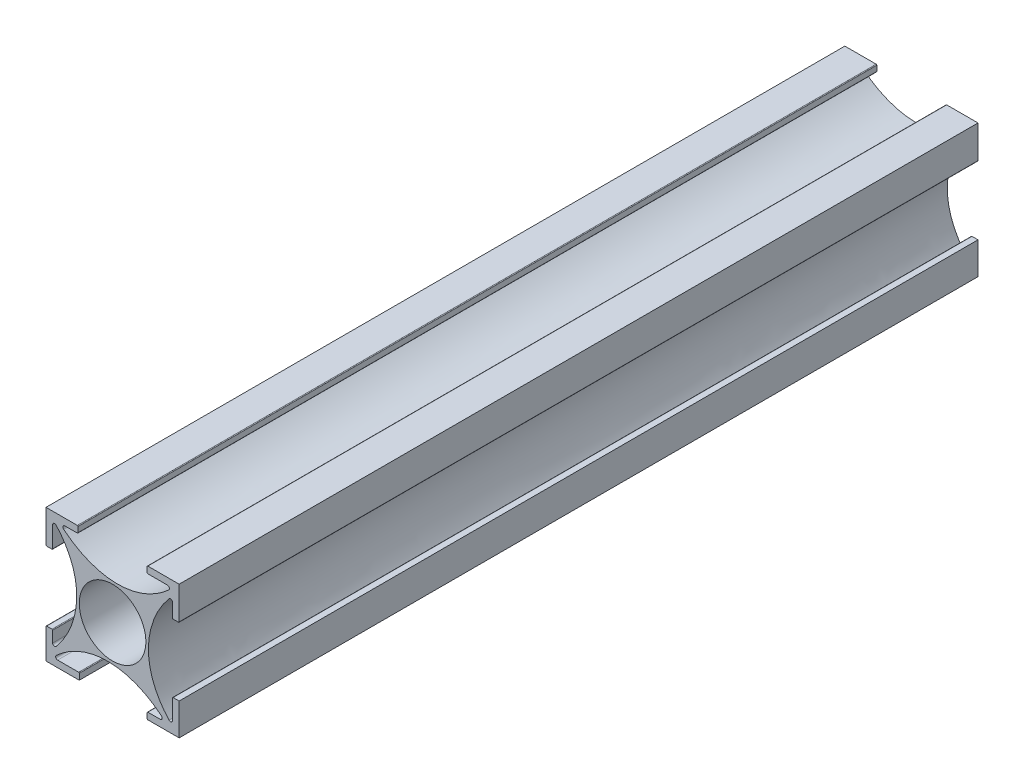
from build123d import *

# Parameters (mm, degrees)
SKETCH1_W           = 20
SKETCH1_H           = 20
BOSS_EXTRUDE1_DEPTH = 120
SKETCH2_R           = 5
BOSS_EXTRUDE2_DEPTH = 120
SKETCH3_W           = 20
SKETCH3_H           = 20
CUT_EXTRUDE1_DEPTH  = 120


with BuildPart() as part:
    # Sketch1 → Boss-Extrude1 (new body)
    with BuildSketch(Plane.XY):
        Rectangle(SKETCH1_W, SKETCH1_H)
    extrude(amount=BOSS_EXTRUDE1_DEPTH)

    # Sketch2 → Boss-Extrude2 (add)
    with BuildSketch(Plane(origin=(0, 0, 0), x_dir=(-1, 0, 0), z_dir=(0, 0, -1))):
        with BuildLine():
            Line((-9, 7.157634185), (-9, 5.1))
            ThreePointArc((-9, 5.1), (-9.029289322, 5.029289322), (-9.1, 5))
            Line((-9.1, 5), (-9.9, 5))
            ThreePointArc((-9.9, 5), (-9.970710678, 5.029289322), (-10, 5.1))
            Line((-10, 5.1), (-10, 10))
            Line((-10, 10), (-5.3, 10))
            ThreePointArc((-5.3, 10), (-5.229289322, 9.970710678), (-5.2, 9.9))
            Line((-5.2, 9.9), (-5.2, 9.1))
            ThreePointArc((-5.2, 9.1), (-5.229289322, 9.029289322), (-5.3, 9))
            Line((-5.3, 9), (-8.248811991, 9))
            ThreePointArc((-8.248811991, 9), (-8.528853178, 8.807596159), (-8.449687699, 8.477179557))
            add(Edge.make_bspline(
                [(7.349220944, 8.469143955), (3.041231185, 4.893955813), (-3.31598224, 3.84907316), (-8.449687699, 8.477179557)],
                knots=[0, 0, 0, 0, 1, 1, 1, 1], degree=3))
            ThreePointArc((7.349220944, 8.469143955), (7.439819243, 8.801841019), (7.157634185, 9))
            Line((7.157634185, 9), (5.3, 9))
            ThreePointArc((5.3, 9), (5.229289322, 9.029289322), (5.2, 9.1))
            Line((5.2, 9.1), (5.2, 9.9))
            ThreePointArc((5.2, 9.9), (5.229289322, 9.970710678), (5.3, 10))
            Line((5.3, 10), (10, 10))
            Line((10, 10), (10, 5.1))
            ThreePointArc((10, 5.1), (9.970710678, 5.029289322), (9.9, 5))
            Line((9.9, 5), (9.1, 5))
            ThreePointArc((9.1, 5), (9.029289322, 5.029289322), (9, 5.1))
            Line((9, 5.1), (9, 8.248811991))
            ThreePointArc((9, 8.248811991), (8.807596159, 8.528853178), (8.477179557, 8.449687699))
            add(Edge.make_bspline(
                [(8.469143955, -7.349220944), (4.893955813, -3.041231185), (3.84907316, 3.31598224), (8.477179557, 8.449687699)],
                knots=[0, 0, 0, 0, 1, 1, 1, 1], degree=3))
            ThreePointArc((8.469143955, -7.349220944), (8.801841019, -7.439819243), (9, -7.157634185))
            Line((9, -7.157634185), (9, -5.5))
            ThreePointArc((9, -5.5), (9.029289322, -5.429289322), (9.1, -5.4))
            Line((9.1, -5.4), (9.9, -5.4))
            ThreePointArc((9.9, -5.4), (9.970710678, -5.429289322), (10, -5.5))
            Line((10, -5.5), (10, -10))
            Line((10, -10), (5, -10))
            Line((5, -10), (5, -9.1))
            ThreePointArc((5, -9.1), (5.029289322, -9.029289322), (5.1, -9))
            Line((5.1, -9), (8.248811991, -9))
            ThreePointArc((8.248811991, -9), (8.528853178, -8.807596159), (8.449687699, -8.477179557))
            add(Edge.make_bspline(
                [(-7.349220944, -8.469143955), (-3.041231185, -4.893955813), (3.31598224, -3.84907316), (8.449687699, -8.477179557)],
                knots=[0, 0, 0, 0, 1, 1, 1, 1], degree=3))
            ThreePointArc((-7.349220944, -8.469143955), (-7.439819243, -8.801841019), (-7.157634185, -9))
            Line((-7.157634185, -9), (-5.3, -9))
            ThreePointArc((-5.3, -9), (-5.229289322, -9.029289322), (-5.2, -9.1))
            Line((-5.2, -9.1), (-5.2, -9.9))
            ThreePointArc((-5.2, -9.9), (-5.229289322, -9.970710678), (-5.3, -10))
            Line((-5.3, -10), (-10, -10))
            Line((-10, -10), (-10, -5.2))
            Line((-10, -5.2), (-9.1, -5.2))
            ThreePointArc((-9.1, -5.2), (-9.029289322, -5.229289322), (-9, -5.3))
            Line((-9, -5.3), (-9, -8.248811991))
            ThreePointArc((-9, -8.248811991), (-8.807596159, -8.528853178), (-8.477179557, -8.449687699))
            add(Edge.make_bspline(
                [(-8.469143955, 7.349220944), (-4.893955813, 3.041231185), (-3.84907316, -3.31598224), (-8.477179557, -8.449687699)],
                knots=[0, 0, 0, 0, 1, 1, 1, 1], degree=3))
            ThreePointArc((-8.469143955, 7.349220944), (-8.801841019, 7.439819243), (-9, 7.157634185))
        make_face()
        Circle(SKETCH2_R, mode=Mode.SUBTRACT)
    extrude(amount=BOSS_EXTRUDE2_DEPTH)

    # Sketch3 → Cut-Extrude1 (cut)
    with BuildSketch(Plane.XY.offset(120)):
        Rectangle(SKETCH3_W, SKETCH3_H)
    extrude(amount=-CUT_EXTRUDE1_DEPTH, mode=Mode.SUBTRACT)


solid = part.part
